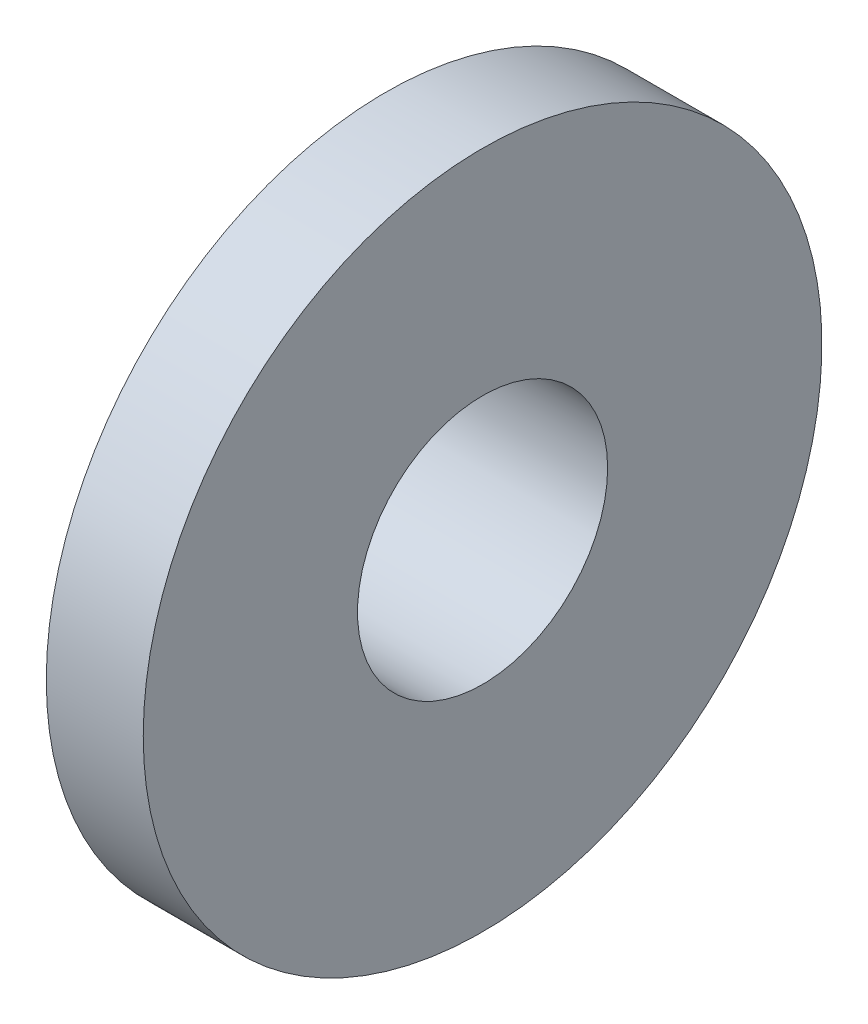
from build123d import *

# Parameters (mm, degrees)
SKETCH1_R           = 4.826
SKETCH1_R_2         = 3.2766
BOSS_EXTRUDE1_DEPTH = 5.334
BOSS_EXTRUDE2_START = 2.54
SKETCH2_R           = 8.89
SKETCH2_R_2         = 3.2766
BOSS_EXTRUDE2_DEPTH = 2.54
FILLET1_R           = 0.889


with BuildPart() as part:
    # Sketch1 → Boss-Extrude1 (new body)
    with BuildSketch(Plane(origin=(0, 0, 0), x_dir=(0, 0, -1), z_dir=(1, 0, 0))):
        Circle(SKETCH1_R)
        Circle(SKETCH1_R_2, mode=Mode.SUBTRACT)
    extrude(amount=BOSS_EXTRUDE1_DEPTH)

    # Sketch2 → Boss-Extrude2 (add)
    with BuildSketch(Plane.ZY.offset(-5.334).offset(BOSS_EXTRUDE2_START)):
        Circle(SKETCH2_R)
        Circle(SKETCH2_R_2, mode=Mode.SUBTRACT)
    extrude(amount=-BOSS_EXTRUDE2_DEPTH)

    # Fillet1
    fillet1_edges = [part.edges().sort_by_distance(p)[0] for p in [
        (2.794, 0, 4.826),
    ]]
    fillet(fillet1_edges, radius=FILLET1_R)


solid = part.part
